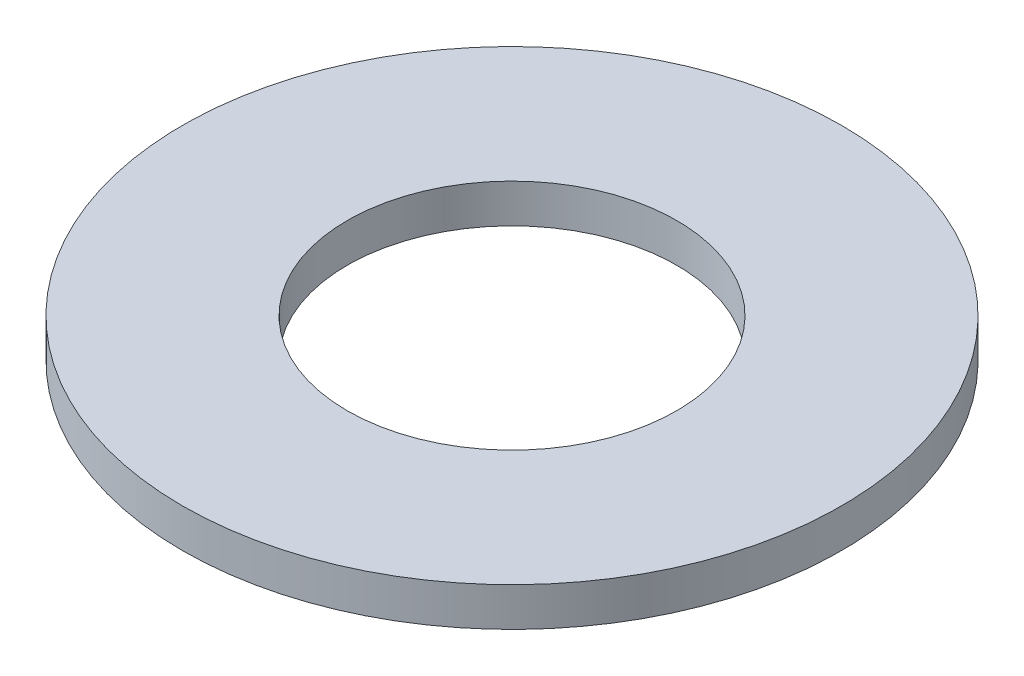
from build123d import *

# Parameters (mm, degrees)
SKETCH1_R           = 85
BOSS_EXTRUDE1_DEPTH = 10
SKETCH2_R           = 42.5
CUT_EXTRUDE1_DEPTH  = 121.623380818


with BuildPart() as part:
    # Sketch1 → Boss-Extrude1 (new body)
    with BuildSketch(Plane(origin=(0, 0, 0), x_dir=(1, 0, 0), z_dir=(0, 1, 0))):
        Circle(SKETCH1_R)
    extrude(amount=BOSS_EXTRUDE1_DEPTH)

    # Sketch2 → Cut-Extrude1 (cut, through all)
    with BuildSketch(Plane(origin=(0, 0, 0), x_dir=(1, 0, 0), z_dir=(0, 1, 0))):
        Circle(SKETCH2_R)
    extrude(amount=CUT_EXTRUDE1_DEPTH, mode=Mode.SUBTRACT)


solid = part.part
